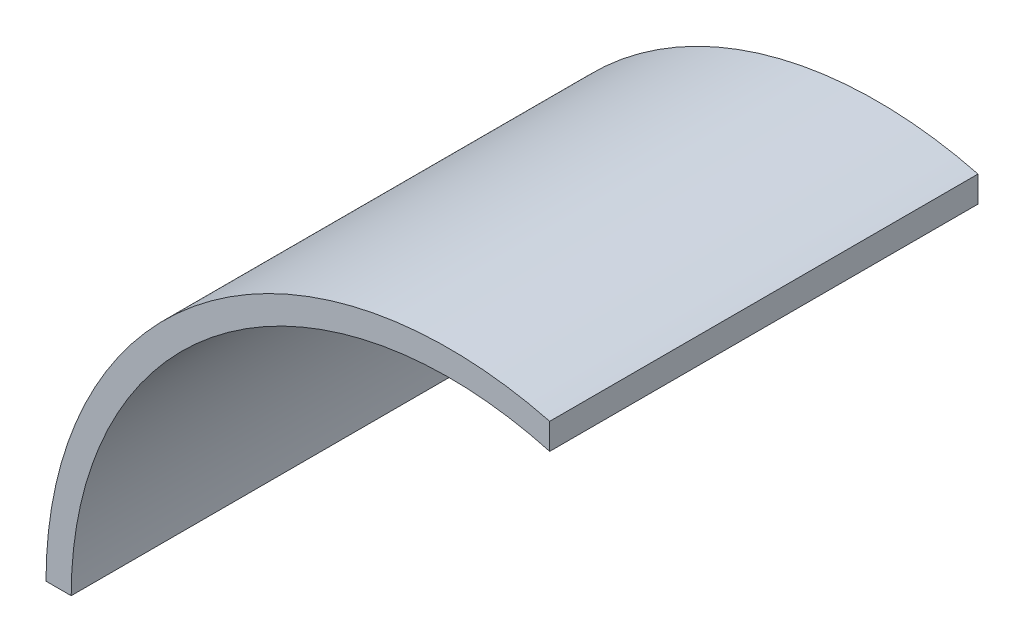
from build123d import *

# Parameters (mm, degrees)
INNER_RING_LEFT_SIDE_DEPTH = 170


with BuildPart() as part:
    # Sketch1 → Inner Ring - Left Side (new body)
    with BuildSketch(Plane.XY):
        with BuildLine():
            Line((39.934342091, 154.936271808), (39.934342091, 144.586473509))
            ThreePointArc((39.934342091, 144.586473509), (-90.856614196, 119.352736277), (-150, 0))
            Line((-150, 0), (-160, 0))
            ThreePointArc((-160, 0), (-98.006390775, 126.470341849), (39.934342091, 154.936271808))
        make_face()
    extrude(amount=INNER_RING_LEFT_SIDE_DEPTH)


solid = part.part
